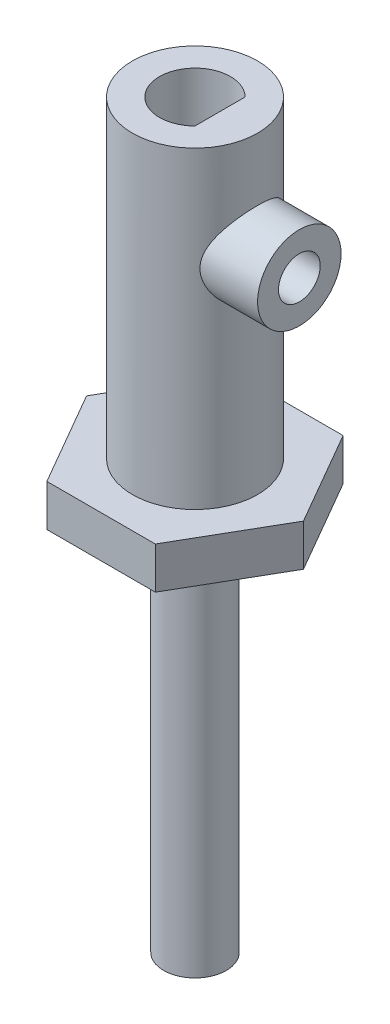
from build123d import *

# Parameters (mm, degrees)
SKETCH1_R                = 3
BOSS_EXTRUDE1_DEPTH      = 17
CUT_EXTRUDE3_DEPTH       = 10.2
BOSS_EXTRUDE2_DEPTH      = 2
SKETCH4_R                = 1.5
BOSS_EXTRUDE3_DEPTH      = 18.5
BOSS_EXTRUDE4_DEPTH      = 2
BOSS_EXTRUDE4_DEPTH_BACK = 1
SKETCH6_R                = 2
SKETCH6_R_2              = 1
SKETCH7_R                = 1.1
CUT_EXTRUDE4_DEPTH       = 3


with BuildPart() as part:
    # Sketch1 → Boss-Extrude1 (new body)
    with BuildSketch(Plane(origin=(0, 0, 0), x_dir=(1, 0, 0), z_dir=(0, 1, 0))):
        Circle(SKETCH1_R)
    extrude(amount=BOSS_EXTRUDE1_DEPTH)

    # Sketch2 → Cut-Extrude3 (cut)
    with BuildSketch(Plane(origin=(0, 17, 0), x_dir=(1, 0, 0), z_dir=(0, 1, 0))):
        with BuildLine():
            Line((1.2, 1.204159458), (1.2, -1.204159458))
            ThreePointArc((1.2, -1.204159458), (-1.7, 0), (1.2, 1.204159458))
        make_face()
    extrude(amount=-CUT_EXTRUDE3_DEPTH, mode=Mode.SUBTRACT)

    # Sketch3 → Boss-Extrude2 (add)
    with BuildSketch(Plane(origin=(0, 0, 0), x_dir=(-1, 0, 0), z_dir=(0, -1, 0))):
        Polygon((5.196152423, 0), (2.598076211, 4.5), (-2.598076211, 4.5), (-5.196152423, 0), (-2.598076211, -4.5), (2.598076211, -4.5), align=None)
    extrude(amount=-BOSS_EXTRUDE2_DEPTH)

    # Sketch4 → Boss-Extrude3 (add)
    with BuildSketch(Plane(origin=(0, 0, 0), x_dir=(-1, 0, 0), z_dir=(0, -1, 0))):
        Circle(SKETCH4_R)
    extrude(amount=BOSS_EXTRUDE3_DEPTH)

    # Sketch6 → Boss-Extrude4 (add, two sides: drawn at the far end of the back side and taken through both)
    with BuildSketch(Plane(origin=(3, 0, 0), x_dir=(0, 0, -1), z_dir=(1, 0, 0)).offset(-BOSS_EXTRUDE4_DEPTH_BACK)):
        with Locations((0, 12)):
            Circle(SKETCH6_R)
        with Locations((0, 12)):
            Circle(SKETCH6_R_2, mode=Mode.SUBTRACT)
    extrude(amount=BOSS_EXTRUDE4_DEPTH + BOSS_EXTRUDE4_DEPTH_BACK)

    # Sketch7 → Cut-Extrude4 (cut)
    with BuildSketch(Plane(origin=(3, 0, 0), x_dir=(0, 0, -1), z_dir=(1, 0, 0))):
        with Locations((0, 12)):
            Circle(SKETCH7_R)
    extrude(amount=-CUT_EXTRUDE4_DEPTH, mode=Mode.SUBTRACT)


solid = part.part
